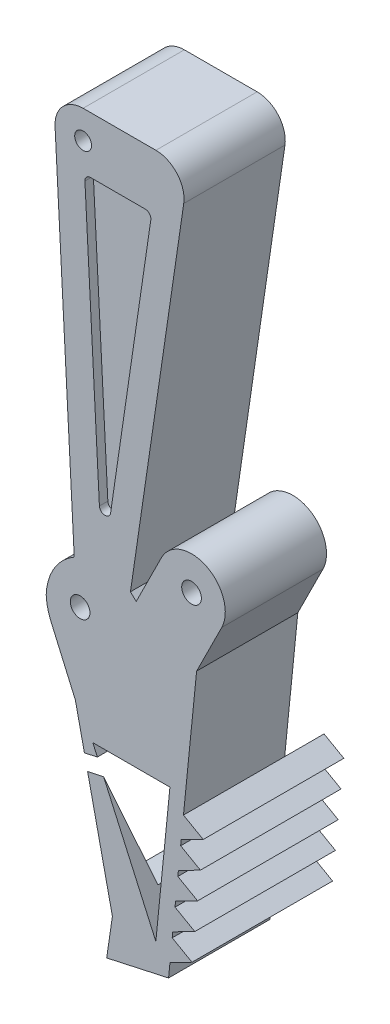
from build123d import *

# Parameters (mm, degrees)
BOSS_EXTRUDE1_DEPTH = 18
CUT_EXTRUDE1_DEPTH  = 25
BOSS_EXTRUDE2_DEPTH = 25
LPATTERN1_COUNT     = 5
LPATTERN1_PITCH     = 5
FILLET1_R           = 10
FILLET2_R           = 5
SKETCH6_R           = 1.5
CUT_EXTRUDE2_DEPTH  = 25
CUT_EXTRUDE3_DEPTH  = 8
SKETCH8_R           = 1.75
CUT_EXTRUDE4_DEPTH  = 61
SKETCH9_R           = 1.75
CUT_EXTRUDE5_DEPTH  = 25
CUT_EXTRUDE6_DEPTH  = 1.5


with BuildPart() as part:
    # Sketch1 → Boss-Extrude1 (new body)
    with BuildSketch(Plane.XY):
        with BuildLine():
            Line((2.499482963, -2.64043917), (12.810164454, 67.606908446))
            Line((12.810164454, 67.606908446), (-11.189835546, 67.606908446))
            Line((-11.189835546, 67.606908446), (-7.494565689, -2.295487655))
            Line((-7.494565689, -2.295487655), (-12.494565689, -2.295487655))
            Line((-12.494565689, -2.295487655), (-12.494565689, -12.295487655))
            Line((-12.494565689, -12.295487655), (-7.295314078, -24.210511057))
            Line((-7.295314078, -24.210511057), (-0.711849738, -54.210511057))
            Line((-0.711849738, -54.210511057), (-1.728395801, -61.136305893))
            Line((-1.728395801, -61.136305893), (9.271604199, -58.722368968))
            Line((9.271604199, -58.722368968), (14.26065829, -8.971898224))
            Line((14.26065829, -8.971898224), (18.725806397, -0.0241358))
            ThreePointArc((18.725806397, -0.0241358), (16.036237527, 8.023610308), (7.988491349, 5.334041648))
            Line((7.988491349, 5.334041648), (3.523343243, -3.613720776))
            Line((3.523343243, -3.613720776), (2.499482963, -2.64043917))
        make_face()
    extrude(amount=BOSS_EXTRUDE1_DEPTH)

    # Sketch4 → Cut-Extrude1 (cut)
    with BuildSketch(Plane(origin=(0, 0, 0), x_dir=(-1, 0, 0), z_dir=(0, 0, -1))):
        Polygon((-7.01051812, -54.210511057), (-9.517556755, -29.210511057), (4.20080561, -29.210511057), align=None)
    extrude(amount=-CUT_EXTRUDE1_DEPTH, mode=Mode.SUBTRACT)

    # Sketch5 → Boss-Extrude2 (add)
    with BuildSketch(Plane.XY.offset(18)):
        Polygon((9.523497192, -56.210511057), (9.924623374, -52.210511057), (13.440851715, -54.210511057), align=None)
    boss_extrude2 = extrude(amount=-BOSS_EXTRUDE2_DEPTH)

    # LPattern1: Boss-Extrude2 ×5
    with Locations(*[Vector(0.09978108182512832, 0.9950094148850086, 0) * (i * LPATTERN1_PITCH) for i in range(1, LPATTERN1_COUNT)]):
        add(boss_extrude2)

    # Fillet1
    # the kernel refuses this fillet: 10 mm, written as the material it takes off along each edge
    with BuildSketch(Plane(origin=(-12.494565689, -12.295487655, -5.216984474), x_dir=(0, 1, 0), z_dir=(0, 0, 1))) as fillet1_piece_1:
        with BuildLine():
            CenterArc((FILLET1_R * 0.208679378975, -FILLET1_R), FILLET1_R, 90, 23.574579649)
            Line((-FILLET1_R * 0.191263052627, -FILLET1_R * 0.0834597382526), (-FILLET1_R * 0.199261901259, -FILLET1_R * 0.0651289330176))
            Line((-FILLET1_R * 0.199261901259, -FILLET1_R * 0.0651289330176), (-FILLET1_R * 0.0041735875795, FILLET1_R * 0.02))
            Line((-FILLET1_R * 0.0041735875795, FILLET1_R * 0.02), (FILLET1_R * 0.208679378975, FILLET1_R * 0.02))
            Line((FILLET1_R * 0.208679378975, FILLET1_R * 0.02), (FILLET1_R * 0.208679378975, 0))
        make_face()
    extrude(amount=28.433968949, mode=Mode.SUBTRACT)
    with BuildSketch(Plane(origin=(-12.494565689, -2.295487655, -21.650635095), x_dir=(1, 0, 0), z_dir=(0, 0, 1))) as fillet1_piece_2:
        with BuildLine():
            CenterArc((10, -8.660254038), FILLET1_R, 120, 60)
            Line((0, -8.660254038), (-0.2, -8.660254038))
            Line((-0.2, -8.660254038), (-0.2, 0))
            Line((-0.2, 0), (0, 0.2))
            ThreePointArc((0, 0.2), (2.5, 0.2), (4.9, 0.173205081))
            Line((4.9, 0.173205081), (5, 0))
        make_face()
    extrude(amount=61.301270189, mode=Mode.SUBTRACT)

    # Fillet2
    fillet2_edges = [part.edges().sort_by_distance(p)[0] for p in [
        (-11.189835546, 67.606908446, 9),
        (12.810164454, 67.606908446, 9),
    ]]
    fillet(fillet2_edges, radius=FILLET2_R)

    # Sketch6 → Cut-Extrude2 (cut)
    with BuildSketch(Plane.XY.offset(18)):
        with Locations((-5.91853771, 62.606908446)):
            Circle(SKETCH6_R)
    extrude(amount=-CUT_EXTRUDE2_DEPTH, mode=Mode.SUBTRACT)

    # Sketch7 → Cut-Extrude3 (cut)
    with BuildSketch(Plane(origin=(-12.028992373, -2.639748078, 0), x_dir=(0, 0, 1), z_dir=(-0.9767573067708646, -0.21434822991974342, 0))):
        Polygon((-0.5, -29.584055917), (18.5, -29.584055917), (15, -48.14094063), (3, -48.14094063), align=None)
    extrude(amount=-CUT_EXTRUDE3_DEPTH, mode=Mode.SUBTRACT)

    # Sketch8 → Cut-Extrude4 (cut)
    with BuildSketch(Plane.XY.offset(18)):
        with Locations((13.357148803, 2.654952784)):
            Circle(SKETCH8_R)
    extrude(amount=-CUT_EXTRUDE4_DEPTH, mode=Mode.SUBTRACT)

    # Sketch9 → Cut-Extrude5 (cut)
    with BuildSketch(Plane(origin=(0, 0, 0), x_dir=(-1, 0, 0), z_dir=(0, 0, -1))):
        with Locations((6.452791989, -9.487217743)):
            Circle(SKETCH9_R)
    extrude(amount=-CUT_EXTRUDE5_DEPTH, mode=Mode.SUBTRACT)

    # Sketch10 → Cut-Extrude6 (cut)
    with BuildSketch(Plane(origin=(0, 0, 0), x_dir=(-1, 0, 0), z_dir=(0, 0, -1))):
        with BuildLine():
            Line((-5.131333655, 57.606908446), (4.599961749, 57.606908446))
            ThreePointArc((4.599961749, 57.606908446), (5.325492441, 57.295098257), (5.598567407, 56.554118877))
            Line((5.598567407, 56.554118877), (3.02178942, 7.809923601))
            ThreePointArc((3.02178942, 7.809923601), (2.069628089, 6.863792291), (1.033784499, 7.717492305))
            Line((1.033784499, 7.717492305), (-6.120732918, 56.46168758))
            ThreePointArc((-6.120732918, 56.46168758), (-5.888043926, 57.260658832), (-5.131333655, 57.606908446))
        make_face()
    cut_extrude6 = extrude(amount=-CUT_EXTRUDE6_DEPTH, mode=Mode.SUBTRACT)

    # Mirror1: Cut-Extrude6 across plane
    add(cut_extrude6.mirror(Plane(origin=(0, 0, 9), x_dir=(1, 0, 0), z_dir=(0, 0, -1))), mode=Mode.SUBTRACT)


solid = part.part
